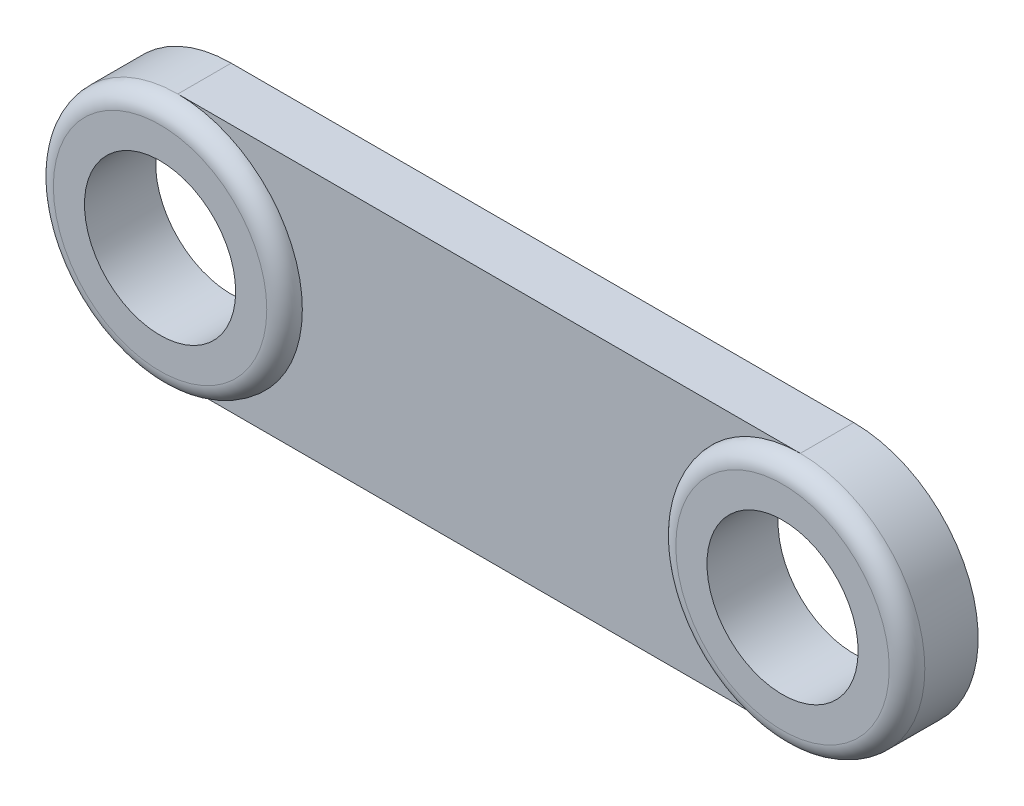
from build123d import *
from build123d.topology import SkipClean

# Parameters (mm, degrees)
SKETCH1_R           = 4.25
SKETCH1_W           = 20
SKETCH1_H           = 5
BOSS_EXTRUDE1_DEPTH = 3
SKETCH2_R           = 7
SKETCH2_R_2         = 4.25
BOSS_EXTRUDE2_DEPTH = 1
FILLET1_R           = 1
CUT_EXTRUDE1_DEPTH  = 48.11952886


with BuildPart() as part:
    # Sketch1 → Boss-Extrude1 (new body)
    with BuildSketch(Plane.XY):
        with BuildLine():
            Line((9, -33.5), (-26, -33.5))
            ThreePointArc((-26, -33.5), (-33, -26.5), (-26, -19.5))
            Line((-26, -19.5), (-20, -19.5))
            ThreePointArc((-20, -19.5), (-16.464466094, -18.035533906), (-15, -14.5))
            Line((-15, -14.5), (-15, 28.5))
            ThreePointArc((-15, 28.5), (-13.535533906, 32.035533906), (-10, 33.5))
            Line((-10, 33.5), (10, 33.5))
            ThreePointArc((10, 33.5), (13.535533906, 32.035533906), (15, 28.5))
            Line((15, 28.5), (15, -22.894448725))
            ThreePointArc((15, -22.894448725), (15.092571663, -29.946820352), (9, -33.5))
        make_face()
        with Locations((9, -26.5)):
            Circle(SKETCH1_R, mode=Mode.SUBTRACT)
        with Locations((-26, -26.5)):
            Circle(SKETCH1_R, mode=Mode.SUBTRACT)
        with Locations((0, 26)):
            Rectangle(SKETCH1_W, SKETCH1_H, mode=Mode.SUBTRACT)
    extrude(amount=BOSS_EXTRUDE1_DEPTH)

    # Sketch2 → Boss-Extrude2 (add)
    # profile 1 of 2: a face of its own
    with BuildSketch(Plane.XY.offset(3)):
        with Locations(Location((-26, -26.5, 0), (0, 0, 270))):
            Circle(SKETCH2_R)
        with Locations((-26, -26.5)):
            Circle(SKETCH2_R_2, mode=Mode.SUBTRACT)
    # profile 2 of 2: a face of its own
    with BuildSketch(Plane.XY.offset(3)):
        with Locations(Location((9, -26.5, 0), (0, 0, 270))):
            Circle(SKETCH2_R)
        with Locations((9, -26.5)):
            Circle(SKETCH2_R_2, mode=Mode.SUBTRACT)
    extrude(amount=BOSS_EXTRUDE2_DEPTH)

    # Fillet1
    fillet1_edges = [part.edges().sort_by_distance(p)[0] for p in [
        (-26, -19.5, 4),
        (9, -19.5, 4),
    ]]
    fillet(fillet1_edges, radius=FILLET1_R - 0.0001)  # a hair under: the kernel refuses the full size

    # Sketch3 → Cut-Extrude1 (cut, through all)
    with SkipClean():  # the faces are left unmerged after this step: merging them gives an invalid solid
        with BuildSketch(Plane.XY.offset(3)):
            with BuildLine():
                Line((-20, -19.5), (9, -19.5))
                ThreePointArc((9, -19.5), (12.446820352, -20.407428337), (15, -22.894448725))
                Line((15, -22.894448725), (15, 33.5))
                Line((15, 33.5), (-20, 33.5))
                Line((-20, 33.5), (-20, -19.5))
            make_face()
        extrude(amount=-CUT_EXTRUDE1_DEPTH, mode=Mode.SUBTRACT)


solid = part.part
